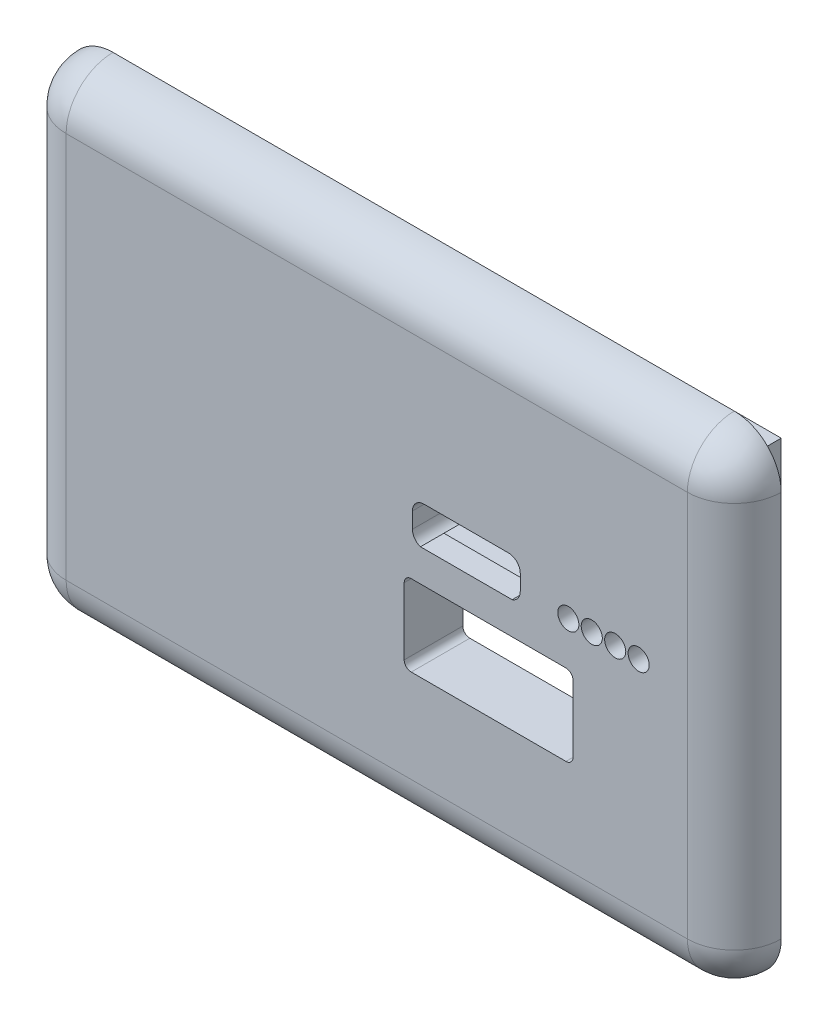
from build123d import *

# Parameters (mm, degrees)
RESSALTO_EXTRUS_O1_DEPTH = 4
ESBO_O8_OUTSIDE_W        = 77.722
ESBO_O8_OUTSIDE_H        = 57.722
ESBO_O8_OUTSIDE_R        = 0.9
CORTE_EXTRUS_O8_DEPTH    = 5
FILETE4_R                = 4
ESBO_O11_W               = 53
ESBO_O11_H               = 33
RESSALTO_EXTRUS_O4_DEPTH = 1
CORTE_EXTRUS_O9_START    = -2
ESBO_O3_OUTSIDE_W        = 77.734
ESBO_O3_OUTSIDE_H        = 57.734
CORTE_EXTRUS_O9_DEPTH    = 8
RESSALTO_EXTRUS_O5_DEPTH = 3
FILETE5_R                = 1
FILETE6_R                = 1


with BuildPart() as part:
    # Esboço1 → Ressalto-extrusão1 (new body)
    with BuildSketch(Plane.XY):
        with BuildLine():
            Line((4, 0), (57, 0))
            ThreePointArc((57, 0), (59.828427125, -1.171572875), (61, -4))
            Line((61, -4), (61, -37))
            ThreePointArc((61, -37), (59.828427125, -39.828427125), (57, -41))
            Line((57, -41), (4, -41))
            ThreePointArc((4, -41), (1.171572875, -39.828427125), (0, -37))
            Line((0, -37), (0, -4))
            ThreePointArc((0, -4), (1.171572875, -1.171572875), (4, 0))
        make_face()
    extrude(amount=RESSALTO_EXTRUS_O1_DEPTH)

    # Esboço8 outside → Corte-extrusão8 (cut)
    # profile 1 of 7: a face of its own
    with BuildSketch(Plane.XY.offset(4)):
        with Locations((30.5, -20.5)):
            Rectangle(ESBO_O8_OUTSIDE_W, ESBO_O8_OUTSIDE_H)
        with BuildLine():
            Line((0, -4), (0, -37))
            ThreePointArc((0, -37), (1.171572875, -39.828427125), (4, -41))
            Line((4, -41), (57, -41))
            ThreePointArc((57, -41), (59.828427125, -39.828427125), (61, -37))
            Line((61, -37), (61, -4))
            ThreePointArc((61, -4), (59.828427125, -1.171572875), (57, 0))
            Line((57, 0), (4, 0))
            ThreePointArc((4, 0), (1.171572875, -1.171572875), (0, -4))
        make_face(mode=Mode.SUBTRACT)
    # profile 2 of 7: a face of its own
    with BuildSketch(Plane.XY.offset(4)):
        with Locations((46.84, -18.41)):
            Circle(ESBO_O8_OUTSIDE_R)
    # profile 3 of 7: a face of its own
    with BuildSketch(Plane.XY.offset(4)):
        with Locations((48.84, -18.41)):
            Circle(ESBO_O8_OUTSIDE_R)
    # profile 4 of 7: a face of its own
    with BuildSketch(Plane.XY.offset(4)):
        with Locations((50.84, -18.41)):
            Circle(ESBO_O8_OUTSIDE_R)
    # profile 5 of 7: a face of its own
    with BuildSketch(Plane.XY.offset(4)):
        with Locations((52.84, -18.41)):
            Circle(ESBO_O8_OUTSIDE_R)
    # profile 6 of 7: a face of its own
    with BuildSketch(Plane.XY.offset(4)):
        with BuildLine():
            Line((34.2277501, -19.41), (42.0522499, -19.41))
            ThreePointArc((42.0522499, -19.41), (42.550015401, -19.046408603), (42.74, -18.46))
            Line((42.74, -18.46), (42.74, -17.11))
            ThreePointArc((42.74, -17.11), (42.447106781, -16.402893219), (41.74, -16.11))
            Line((41.74, -16.11), (34.54, -16.11))
            ThreePointArc((34.54, -16.11), (33.832893219, -16.402893219), (33.54, -17.11))
            Line((33.54, -17.11), (33.54, -18.46))
            ThreePointArc((33.54, -18.46), (33.729984599, -19.046408603), (34.2277501, -19.41))
        make_face()
    # profile 7 of 7: a face of its own
    with BuildSketch(Plane.XY.offset(4)):
        with BuildLine():
            Line((32.84, -22.76), (32.84, -28.46))
            ThreePointArc((32.84, -28.46), (33.015735931, -28.884264069), (33.44, -29.06))
            Line((33.44, -29.06), (46.64, -29.06))
            ThreePointArc((46.64, -29.06), (47.064264069, -28.884264069), (47.24, -28.46))
            Line((47.24, -28.46), (47.24, -22.76))
            ThreePointArc((47.24, -22.76), (47.064264069, -22.335735931), (46.64, -22.16))
            Line((46.64, -22.16), (33.44, -22.16))
            ThreePointArc((33.44, -22.16), (33.015735931, -22.335735931), (32.84, -22.76))
        make_face()
    extrude(amount=-CORTE_EXTRUS_O8_DEPTH, mode=Mode.SUBTRACT)

    # Filete4
    filete4_edges = [part.edges().sort_by_distance(p)[0] for p in [
        (1.171572875, -1.171572875, 4),
        (0, -20.5, 4),
        (1.171572875, -39.828427125, 4),
        (30.5, -41, 4),
        (59.828427125, -39.828427125, 4),
        (61, -20.5, 4),
        (59.828427125, -1.171572875, 4),
        (30.5, 0, 4),
    ]]
    fillet(filete4_edges, radius=FILETE4_R - 0.0001)  # a hair under: the kernel refuses the full size

    # Esboço11 → Ressalto-extrusão4 (add)
    with BuildSketch(Plane(origin=(0, 0, 0), x_dir=(-1, 0, 0), z_dir=(0, 0, -1))):
        with Locations((-30.5, -20.5)):
            Rectangle(ESBO_O11_W, ESBO_O11_H)
    extrude(amount=RESSALTO_EXTRUS_O4_DEPTH)

    # Esboço3 outside → Corte-extrusão9 (cut)
    # profile 1 of 3: a face of its own
    with BuildSketch(Plane.XY.offset(4).offset(CORTE_EXTRUS_O9_START)):
        with Locations((30.5, -20.5)):
            Rectangle(ESBO_O3_OUTSIDE_W, ESBO_O3_OUTSIDE_H)
        with BuildLine():
            Line((0, -4), (0, -37))
            ThreePointArc((0, -37), (1.171572875, -39.828427125), (4, -41))
            Line((4, -41), (57, -41))
            ThreePointArc((57, -41), (59.828427125, -39.828427125), (61, -37))
            Line((61, -37), (61, -4))
            ThreePointArc((61, -4), (59.828427125, -1.171572875), (57, 0))
            Line((57, 0), (4, 0))
            ThreePointArc((4, 0), (1.171572875, -1.171572875), (0, -4))
        make_face(mode=Mode.SUBTRACT)
    # profile 2 of 3: a face of its own
    with BuildSketch(Plane.XY.offset(4).offset(CORTE_EXTRUS_O9_START)):
        with BuildLine():
            Line((53.69, -18.41), (53.69, -19.41))
            Line((53.69, -19.41), (56.34, -19.41))
            Line((56.34, -19.41), (56.34, -21.01))
            Line((56.34, -21.01), (30.24, -21.01))
            Line((30.24, -21.01), (30.24, -19.41))
            Line((30.24, -19.41), (34.2277501, -19.41))
            ThreePointArc((34.2277501, -19.41), (33.729984599, -19.046408603), (33.54, -18.46))
            Line((33.54, -18.46), (33.54, -17.11))
            ThreePointArc((33.54, -17.11), (33.832893219, -16.402893219), (34.54, -16.11))
            Line((34.54, -16.11), (41.74, -16.11))
            ThreePointArc((41.74, -16.11), (42.447106781, -16.402893219), (42.74, -17.11))
            Line((42.74, -17.11), (42.74, -18.46))
            ThreePointArc((42.74, -18.46), (42.550015401, -19.046408603), (42.0522499, -19.41))
            Line((42.0522499, -19.41), (43.99, -19.41))
            Line((43.99, -19.41), (43.99, -18.41))
            ThreePointArc((43.99, -18.41), (44.68752686, -17.573787143), (45.635298686, -18.11))
            Line((45.635298686, -18.11), (46.044701314, -18.11))
            ThreePointArc((46.044701314, -18.11), (46.84, -17.56), (47.635298686, -18.11))
            Line((47.635298686, -18.11), (48.044701314, -18.11))
            ThreePointArc((48.044701314, -18.11), (48.84, -17.56), (49.635298686, -18.11))
            Line((49.635298686, -18.11), (50.044701314, -18.11))
            ThreePointArc((50.044701314, -18.11), (50.84, -17.56), (51.635298686, -18.11))
            Line((51.635298686, -18.11), (52.044701314, -18.11))
            ThreePointArc((52.044701314, -18.11), (52.99247314, -17.573787143), (53.69, -18.41))
        make_face()
    # profile 3 of 3: a face of its own
    with BuildSketch(Plane.XY.offset(4).offset(CORTE_EXTRUS_O9_START)):
        with BuildLine():
            Line((33.44, -22.16), (46.64, -22.16))
            ThreePointArc((46.64, -22.16), (47.064264069, -22.335735931), (47.24, -22.76))
            Line((47.24, -22.76), (47.24, -28.46))
            ThreePointArc((47.24, -28.46), (47.064264069, -28.884264069), (46.64, -29.06))
            Line((46.64, -29.06), (33.44, -29.06))
            ThreePointArc((33.44, -29.06), (33.015735931, -28.884264069), (32.84, -28.46))
            Line((32.84, -28.46), (32.84, -22.76))
            ThreePointArc((32.84, -22.76), (33.015735931, -22.335735931), (33.44, -22.16))
        make_face()
    extrude(amount=-CORTE_EXTRUS_O9_DEPTH, mode=Mode.SUBTRACT)

    # Esboço13 → Ressalto-extrusão5 (add)
    with BuildSketch(Plane(origin=(0, 0, -1), x_dir=(-1, 0, 0), z_dir=(0, 0, -1))):
        Polygon((-57, -4), (-4, -4), (-4, -37), (-57, -37), (-57, -25), (-55, -25), (-55, -35), (-6, -35), (-6, -6), (-55, -6), (-55, -15.992966124), (-57, -15.992966124), align=None)
    extrude(amount=RESSALTO_EXTRUS_O5_DEPTH)

    # Filete5
    filete5_edges = [part.edges().sort_by_distance(p)[0] for p in [
        (56, -15.992966124, -4),
    ]]
    fillet(filete5_edges, radius=FILETE5_R)

    # Filete6
    filete6_edges = [part.edges().sort_by_distance(p)[0] for p in [
        (56, -25, -4),
    ]]
    fillet(filete6_edges, radius=FILETE6_R)


solid = part.part
